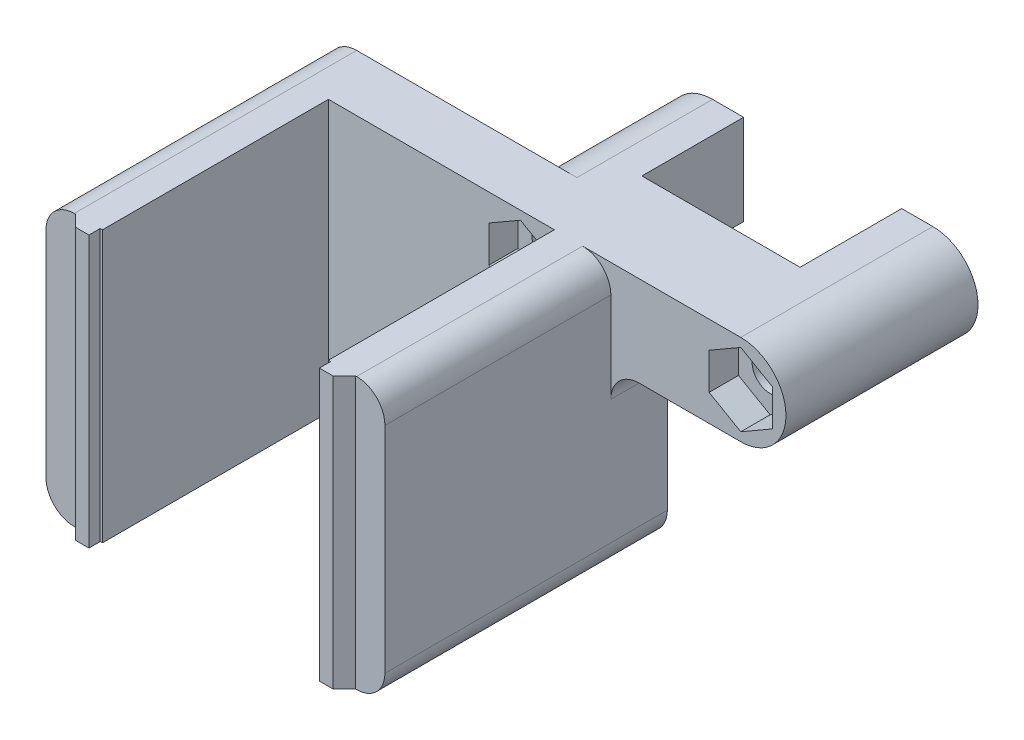
from build123d import *

# Parameters (mm, degrees)
SKETCH_1_W                  = 30
SKETCH_1_H                  = 24
EXTRUDE_1_DEPTH             = 5
SKETCH_2_W                  = 5
SKETCH_2_H                  = 24
EXTRUDE_2_DEPTH             = 20
EXTRUDE_3_DEPTH             = 24
SKETCH_4_R                  = 2.6
CUT_EXTRUDE_1_DEPTH         = 47.389654019
EXTRUDE_4_DEPTH             = 12
EXTRUDE_4_DIRECTION_2_REACH = 48.39
SKETCH_6_W                  = 14
SKETCH_6_H                  = 8
CUT_EXTRUDE_2_DEPTH         = 9
SKETCH_7_R                  = 1.6
CUT_EXTRUDE_3_DEPTH         = 64.955062348
CUT_EXTRUDE_4_DEPTH         = 2.6
SKETCH_10_R                 = 6
EXTRUDE_5_DEPTH             = 1
FILLET_1_R                  = 2.5
FILLET_2_R                  = 2.5
CHAMFER_1_SIZE              = 1


with BuildPart() as part:
    # Эскиз1 → Бобышка-Вытянуть1 (new body)
    with BuildSketch(Plane.XY):
        with Locations((15, -12)):
            Rectangle(SKETCH_1_W, SKETCH_1_H)
    extrude(amount=EXTRUDE_1_DEPTH)

    # Эскиз2 → Бобышка-Вытянуть2 (add)
    with BuildSketch(Plane.XY.offset(5)):
        with Locations((2.5, -12)):
            Rectangle(SKETCH_2_W, SKETCH_2_H)
        with Locations((27.5, -12)):
            Rectangle(SKETCH_2_W, SKETCH_2_H)
    extrude(amount=EXTRUDE_2_DEPTH)

    # Эскиз3 → Бобышка-Вытянуть3 (add)
    with BuildSketch(Plane(origin=(0, 0, 0), x_dir=(1, 0, 0), z_dir=(0, 1, 0))):
        Polygon((25.2, -25), (25.2, -26), (26.4, -26), (27.4, -25), align=None)
        Polygon((4.8, -25), (4.8, -26), (3.6, -26), (2.6, -25), align=None)
    extrude(amount=-EXTRUDE_3_DEPTH)

    # Эскиз4 → Вырез-Вытянуть1 (cut, through all)
    with BuildSketch(Plane(origin=(0, 0, 0), x_dir=(-1, 0, 0), z_dir=(0, 0, -1))):
        with Locations((-15, -14)):
            Circle(SKETCH_4_R)
    extrude(amount=-CUT_EXTRUDE_1_DEPTH, mode=Mode.SUBTRACT)

    # Эскиз5 → Бобышка-Вытянуть4 (add)
    with BuildSketch(Plane(origin=(0, 0, 0), x_dir=(-1, 0, 0), z_dir=(0, 0, -1))):
        with BuildLine():
            Line((-22, 0), (-41.5, 0))
            ThreePointArc((-41.5, 0), (-45.5, -4), (-41.5, -8))
            Line((-41.5, -8), (-22, -8))
            ThreePointArc((-22, -8), (-18, -4), (-22, 0))
        make_face()
    extrude(amount=EXTRUDE_4_DEPTH)

    # Бобышка-Вытянуть4 direction 2: up to this face of the body (flat: up to its plane)
    extrude_4_direction_2_end = Plane(part.part.faces().sort_by_distance((5.312409987, -12, 5))[0])
    # Эскиз5 → Бобышка-Вытянуть4 direction 2 (add, up to the picked face)
    with BuildSketch(Plane(origin=(0, 0, 0), x_dir=(-1, 0, 0), z_dir=(0, 0, -1)), mode=Mode.PRIVATE) as extrude_4_direction_2_sk1:
        with BuildLine():
            Line((-22, 0), (-41.5, 0))
            ThreePointArc((-41.5, 0), (-45.5, -4), (-41.5, -8))
            Line((-41.5, -8), (-22, -8))
            ThreePointArc((-22, -8), (-18, -4), (-22, 0))
        make_face()
    extrude_4_direction_2_tool1 = split(extrude(extrude_4_direction_2_sk1.sketch, amount=-EXTRUDE_4_DIRECTION_2_REACH, mode=Mode.PRIVATE), bisect_by=extrude_4_direction_2_end, keep=Keep.BOTH, mode=Mode.PRIVATE)
    add(extrude_4_direction_2_tool1.solids().sort_by(Axis((31.75, -4, 0), (0, 0, 1)))[0])

    # Эскиз6 → Вырез-Вытянуть2 (cut)
    with BuildSketch(Plane(origin=(0, 0, -12), x_dir=(-1, 0, 0), z_dir=(0, 0, -1))):
        with Locations((-31.75, -4)):
            Rectangle(SKETCH_6_W, SKETCH_6_H)
    extrude(amount=-CUT_EXTRUDE_2_DEPTH, mode=Mode.SUBTRACT)

    # Эскиз7 → Вырез-Вытянуть3 (cut, through all)
    with BuildSketch(Plane(origin=(0, 0, -12), x_dir=(-1, 0, 0), z_dir=(0, 0, -1))):
        with Locations((-22, -4)):
            Circle(SKETCH_7_R)
        with Locations((-41.5, -4)):
            Circle(SKETCH_7_R)
    extrude(amount=-CUT_EXTRUDE_3_DEPTH, mode=Mode.SUBTRACT)

    # Эскиз8 → Вырез-Вытянуть4 (cut)
    with BuildSketch(Plane.XY.offset(5)):
        Polygon((41.5, -0.766838493), (38.7, -2.383419246), (38.7, -5.616580754), (41.5, -7.233161507), (44.3, -5.616580754), (44.3, -2.383419246), align=None)
        Polygon((22, -0.766838493), (19.2, -2.383419246), (19.2, -5.616580754), (22, -7.233161507), (24.8, -5.616580754), (24.8, -2.383419246), align=None)
    extrude(amount=-CUT_EXTRUDE_4_DEPTH, mode=Mode.SUBTRACT)

    # Эскиз10 → Бобышка-Вытянуть5 (add)
    with BuildSketch(Plane(origin=(0, 0, 0), x_dir=(-1, 0, 0), z_dir=(0, 0, -1))):
        with Locations(Location((-15, -14, 0), (0, 0, 180))):
            Circle(SKETCH_10_R)
        Polygon((-15, -18.734272207), (-10.9, -16.367136104), (-10.9, -11.632863896), (-15, -9.265727793), (-19.1, -11.632863896), (-19.1, -16.367136104), align=None, mode=Mode.SUBTRACT)
    extrude(amount=EXTRUDE_5_DEPTH)

    # Скругление1
    fillet_1_edges = [part.edges().sort_by_distance(p)[0] for p in [
        (0, 0, 12.5),
        (30, 0, 15),
        (30, -24, 12.5),
        (0, -24, 12.5),
    ]]
    fillet(fillet_1_edges, radius=FILLET_1_R)

    # Скругление2
    fillet_2_edges = [part.edges().sort_by_distance(p)[0] for p in [
        (30, -8, 2.5),
    ]]
    fillet(fillet_2_edges, radius=FILLET_2_R)

    # Фаска1
    chamfer_1_edges = [part.edges().sort_by_distance(p)[0] for p in [
        (9, -14, 0),
    ]]
    chamfer(chamfer_1_edges, length=CHAMFER_1_SIZE - 0.0001)  # a hair under: the kernel refuses the full size


solid = part.part
